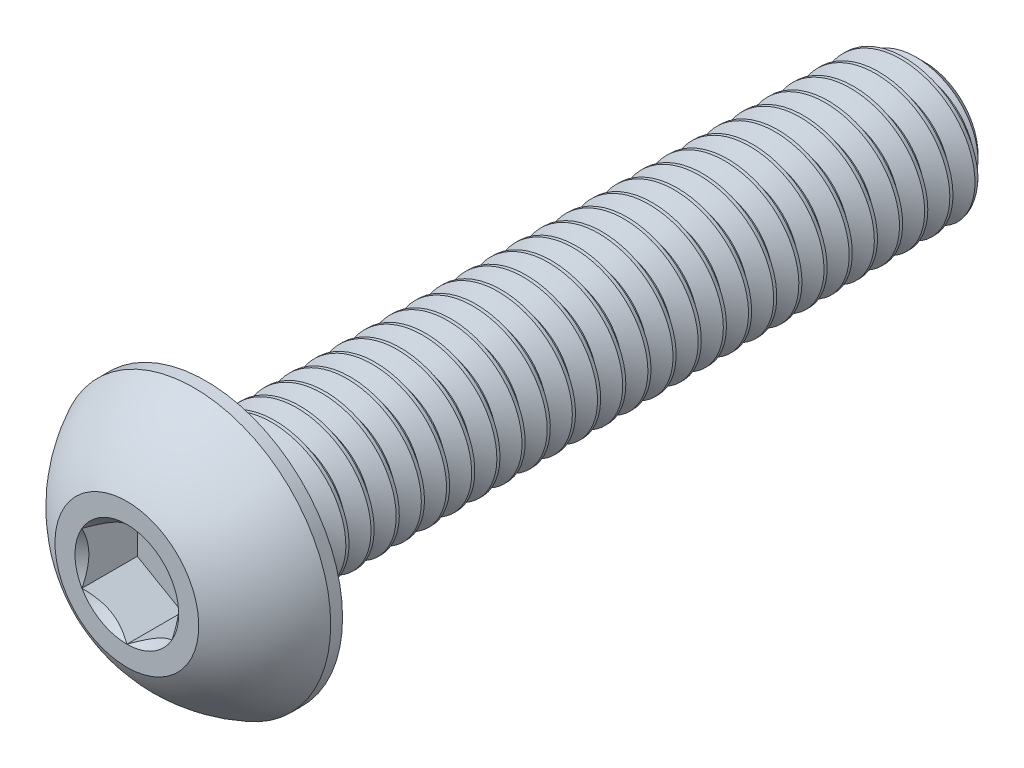
from build123d import *

# Parameters (mm, degrees)
SKETCH1_W          = 20
SKETCH1_H          = 2
CHAMFER1_SIZE      = 0.525
CUT_SWEEP1_PITCH   = 0.7
CUT_EXTRUDE2_DEPTH = 1.54


with BuildPart() as part:
    # Sketch1 → Revolve1 (revolve)
    with BuildSketch(Plane(origin=(0, 0, 0), x_dir=(0, 0, -1), z_dir=(1, 0, 0))):
        with Locations((12.2, 1)):
            Rectangle(SKETCH1_W, SKETCH1_H)
    revolve(axis=Axis((0, 0, -22.2), (0, 0, 1)))

    # Chamfer1
    chamfer1_edges = [part.edges().sort_by_distance(p)[0] for p in [
        (0, -2, -22.2),
    ]]
    chamfer(chamfer1_edges, length=CHAMFER1_SIZE)

    # Cut-Sweep1: the profile of Sketch2 profile screwed along a right-hand helix of 29.571429 turns, 6 arcs to a turn; built about Z, then put on its axis
    cut_sweep1_z = Axis((0, 0, 0), (0, 0, 1))
    cut_sweep1_corners = [(2.0003, 0, 0.000173205), (2.0003, 0, -0.612673205), (1.545336663, 0, -0.35), (1.545336663, 0, -0.2625)]
    with BuildLine(mode=Mode.PRIVATE) as cut_sweep1_profile:
        Line(cut_sweep1_corners[0], cut_sweep1_corners[1])
        Line(cut_sweep1_corners[1], cut_sweep1_corners[2])
        Line(cut_sweep1_corners[2], cut_sweep1_corners[3])
        Line(cut_sweep1_corners[3], cut_sweep1_corners[0])
    cut_sweep1_cap = Face(cut_sweep1_profile.wire())
    cut_sweep1_turn_angles = [0, 30, 60, 90, 120, 150, 180, 210, 240, 270, 300, 330, 360]
    cut_sweep1_turn_weights = [1, 0.8660254037844387, 1, 0.8660254037844387, 1, 0.8660254037844387, 1, 0.8660254037844387, 1, 0.8660254037844387, 1, 0.8660254037844387, 1]
    cut_sweep1_turn_rails = [Edge.make_bspline([Vector(p[0], p[1], 0).rotate(cut_sweep1_z, cut_sweep1_turn_angles[k]) / cut_sweep1_turn_weights[k] + Vector(0, 0, p[2] + CUT_SWEEP1_PITCH * cut_sweep1_turn_angles[k] / 360) for k in range(13)], [0, 0, 0, 1, 1, 2, 2, 3, 3, 4, 4, 5, 5, 6, 6, 6], 2, cut_sweep1_turn_weights) for p in cut_sweep1_corners]
    cut_sweep1_turn_sides = [Face.make_surface_from_curves(cut_sweep1_turn_rails[p[0]], cut_sweep1_turn_rails[p[1]]) for p in [(0, 1), (1, 2), (2, 3), (3, 0)]]
    cut_sweep1_last_angles = [10440, 10470, 10500, 10530, 10560, 10590, 10620, 10632.857142857, 10645.714285714]
    cut_sweep1_last_weights = [1, 0.8660254037844387, 1, 0.8660254037844387, 1, 0.8660254037844387, 1, 0.9749279121817414, 1]
    cut_sweep1_last_rails = [Edge.make_bspline([Vector(p[0], p[1], 0).rotate(cut_sweep1_z, cut_sweep1_last_angles[k]) / cut_sweep1_last_weights[k] + Vector(0, 0, p[2] + CUT_SWEEP1_PITCH * cut_sweep1_last_angles[k] / 360) for k in range(9)], [0, 0, 0, 1, 1, 2, 2, 3, 3, 4, 4, 4], 2, cut_sweep1_last_weights) for p in cut_sweep1_corners]
    cut_sweep1_last_sides = [Face.make_surface_from_curves(cut_sweep1_last_rails[p[0]], cut_sweep1_last_rails[p[1]]) for p in [(0, 1), (1, 2), (2, 3), (3, 0)]]
    cut_sweep1 = Plane(origin=(0, 0, -22.2), x_dir=(0, 1, 0), z_dir=(0, 0, 1)) * Solid(Shell([*[p.moved(Location((0, 0, CUT_SWEEP1_PITCH * i))) for i in range(29) for p in cut_sweep1_turn_sides], *cut_sweep1_last_sides, cut_sweep1_cap, cut_sweep1_cap.rotate(cut_sweep1_z, 10645.714285714).moved(Location((0, 0, CUT_SWEEP1_PITCH * 10645.714285714 / 360)))]))
    add(cut_sweep1, mode=Mode.SUBTRACT)

    # Sketch7 → Revolve2 (revolve)
    with BuildSketch(Plane(origin=(0, 0, 0), x_dir=(0, 0, -1), z_dir=(1, 0, 0)), mode=Mode.PRIVATE) as revolve2_sk:
        with BuildLine():
            Line((1.87, 3.8), (2.2, 3.8))
            Line((2.2, 3.8), (2.2, 0))
            Line((2.2, 0), (0, 0))
            Line((0, 0), (0, 2))
            ThreePointArc((0, 2), (0.793500147, 3.047002626), (1.87, 3.8))
        make_face()
    revolve(revolve2_sk.sketch.rotate(Axis((0, 0, 0), (0, 0, -1)), 189.336081704), axis=Axis((0, 0, 0), (0, 0, -1)))

    # Sketch5 → Cut-Extrude2 (cut)
    with BuildSketch(Plane.XY):
        Polygon((1.25, -0.721687836), (1.25, 0.721687836), (0, 1.443375673), (-1.25, 0.721687836), (-1.25, -0.721687836), (0, -1.443375673), align=None)
    extrude(amount=-CUT_EXTRUDE2_DEPTH, mode=Mode.SUBTRACT)

    # Cut-Extrude3 cone 1 section (through the dimple's axis) → Cut-Extrude3 (revolve, cut)
    with BuildSketch(Plane(origin=(0, 0, 0), x_dir=(0, -1, 0), z_dir=(1, 0, 0))):
        Polygon((0, 0), (1.443375673, 0), (0, 1.443375673), align=None)
    revolve(axis=Axis((0, 0, 0), (0, 0, -1)), mode=Mode.SUBTRACT)


solid = part.part
